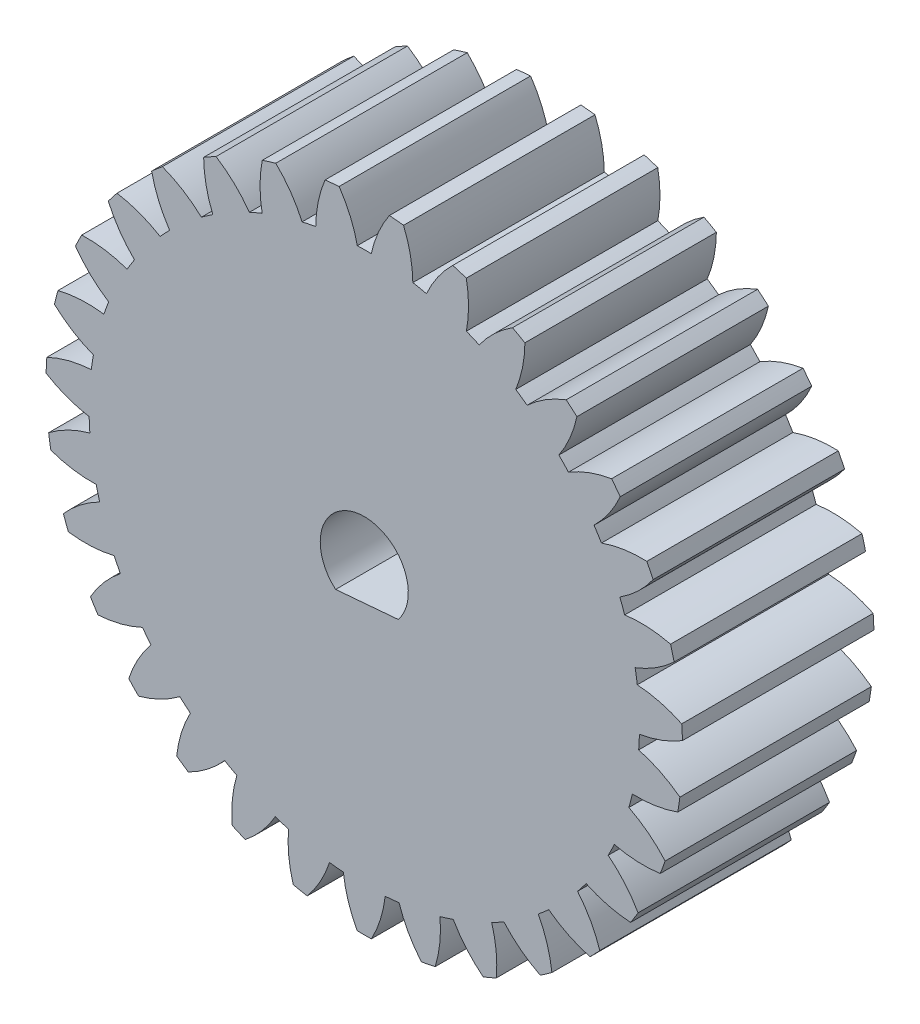
from build123d import *

# Parameters (mm, degrees)
BOSS_EXTRUDE1_DEPTH = 10


with BuildPart() as part:
    # Model → Boss-Extrude1 (new body)
    with BuildSketch(Plane.XY):
        with BuildLine():
            ThreePointArc((14.369367897, -0.364886625), (15.533878417, -0.05414421), (16.618302644, 0.4718498))
            ThreePointArc((16.618302644, 0.4718498), (16.603661932, 0.842042432), (16.58077576, 1.211816902))
            ThreePointArc((16.58077576, 1.211816902), (15.448701432, 1.625402827), (14.25872835, 1.816739348))
            ThreePointArc((14.25872835, 1.816739348), (14.208243694, 2.176622874), (14.148677229, 2.535115118))
            ThreePointArc((14.148677229, 2.535115118), (15.226798163, 3.073910862), (16.183142346, 3.807430735))
            ThreePointArc((16.183142346, 3.807430735), (16.094282101, 4.167098349), (15.997429357, 4.524696561))
            ThreePointArc((15.997429357, 4.524696561), (14.805274422, 4.701931471), (13.6011444, 4.649811502))
            ThreePointArc((13.6011444, 4.649811502), (13.479249148, 4.992165704), (13.348738054, 5.33132895))
            ThreePointArc((13.348738054, 5.33132895), (14.296331003, 6.076119662), (15.085442299, 6.987135009))
            ThreePointArc((15.085442299, 6.987135009), (14.92600047, 7.32155277), (14.759146317, 7.652334612))
            ThreePointArc((14.759146317, 7.652334612), (13.555717739, 7.585962488), (12.386728002, 7.292519826))
            ThreePointArc((12.386728002, 7.292519826), (12.198412557, 7.603328684), (12.002299974, 7.909277549))
            ThreePointArc((12.002299974, 7.909277549), (12.780570371, 8.829571409), (13.370142472, 9.880785155))
            ThreePointArc((13.370142472, 9.880785155), (13.146646627, 10.17626196), (12.916622092, 10.466685184))
            ThreePointArc((12.916622092, 10.466685184), (11.751188378, 10.15942331), (10.665197503, 9.636671533))
            ThreePointArc((10.665197503, 9.636671533), (10.418171524, 9.903210495), (10.164486323, 10.163419395))
            ThreePointArc((10.164486323, 10.163419395), (10.741571688, 11.221539465), (11.107467442, 12.369914795))
            ThreePointArc((11.107467442, 12.369914795), (10.829067525, 12.61435379), (10.545289841, 12.852528435))
            ThreePointArc((10.545289841, 12.852528435), (9.465563984, 12.316956148), (8.507032565, 11.586296774))
            ThreePointArc((8.507032565, 11.586296774), (8.211409324, 11.797653704), (7.910537407, 12.001469657))
            ThreePointArc((7.910537407, 12.001469657), (8.262811797, 13.154096377), (8.390051389, 14.35261867))
            ThreePointArc((8.390051389, 14.35261867), (8.068145127, 14.536012493), (7.742232185, 14.712187662))
            ThreePointArc((7.742232185, 14.712187662), (6.792418289, 13.970231354), (6.000588715, 13.061577664))
            ThreePointArc((6.000588715, 13.061577664), (5.668471061, 13.209099584), (5.332730161, 13.348178341))
            ThreePointArc((5.332730161, 13.348178341), (5.44577142, 14.548123038), (5.329145646, 15.747724651))
            ThreePointArc((5.329145646, 15.747724651), (4.97691192, 15.862565138), (4.622206634, 15.969528197))
            ThreePointArc((4.622206634, 15.969528197), (3.84119019, 15.051563646), (3.248480058, 14.00211603))
            ThreePointArc((3.248480058, 14.00211603), (2.893464928, 14.079763376), (2.536600316, 14.148411036))
            ThreePointArc((2.536600316, 14.148411036), (2.405780521, 15.346547832), (2.050064055, 16.498116934))
            ThreePointArc((2.050064055, 16.498116934), (1.681923353, 16.539702501), (1.3129474, 16.573074372))
            ThreePointArc((1.3129474, 16.573074372), (0.732703314, 15.516683155), (0.363378245, 14.36940612))
            ThreePointArc((0.363378245, 14.36940612), (0, 14.374), (-0.363378245, 14.36940612))
            ThreePointArc((-0.363378245, 14.36940612), (-0.732703314, 15.516683155), (-1.3129474, 16.573074372))
            ThreePointArc((-1.3129474, 16.573074372), (-1.681923353, 16.539702501), (-2.050064055, 16.498116934))
            ThreePointArc((-2.050064055, 16.498116934), (-2.405780521, 15.346547832), (-2.536600315, 14.148411036))
            ThreePointArc((-2.536600315, 14.148411036), (-2.893464928, 14.079763376), (-3.248480058, 14.00211603))
            ThreePointArc((-3.248480058, 14.00211603), (-3.84119019, 15.051563647), (-4.622206634, 15.969528197))
            ThreePointArc((-4.622206634, 15.969528197), (-4.976911919, 15.862565138), (-5.329145646, 15.747724651))
            ThreePointArc((-5.329145646, 15.747724651), (-5.44577142, 14.548123037), (-5.33273016, 13.34817834))
            ThreePointArc((-5.33273016, 13.34817834), (-5.668471061, 13.209099583), (-6.000588714, 13.061577663))
            ThreePointArc((-6.000588714, 13.061577663), (-6.792418288, 13.970231353), (-7.742232185, 14.71218766))
            ThreePointArc((-7.742232185, 14.71218766), (-8.068145126, 14.536012492), (-8.390051388, 14.352618669))
            ThreePointArc((-8.390051388, 14.352618669), (-8.262811796, 13.154096376), (-7.910537407, 12.001469656))
            ThreePointArc((-7.910537407, 12.001469656), (-8.211409323, 11.797653703), (-8.507032564, 11.586296773))
            ThreePointArc((-8.507032564, 11.586296773), (-9.465563983, 12.316956147), (-10.54528984, 12.852528434))
            ThreePointArc((-10.54528984, 12.852528434), (-10.829067524, 12.614353789), (-11.107467441, 12.369914794))
            ThreePointArc((-11.107467441, 12.369914794), (-10.741571687, 11.221539464), (-10.164486322, 10.163419394))
            ThreePointArc((-10.164486322, 10.163419394), (-10.418171523, 9.903210494), (-10.665197502, 9.636671532))
            ThreePointArc((-10.665197502, 9.636671532), (-11.751188377, 10.159423309), (-12.916622091, 10.466685183))
            ThreePointArc((-12.916622091, 10.466685183), (-13.146646626, 10.176261959), (-13.370142471, 9.880785154))
            ThreePointArc((-13.370142471, 9.880785154), (-12.78057037, 8.829571408), (-12.002299973, 7.909277548))
            ThreePointArc((-12.002299973, 7.909277548), (-12.198412556, 7.603328684), (-12.386728, 7.292519826))
            ThreePointArc((-12.386728, 7.292519826), (-13.555717737, 7.585962488), (-14.759146315, 7.652334611))
            ThreePointArc((-14.759146315, 7.652334611), (-14.926000469, 7.321552769), (-15.085442298, 6.987135008))
            ThreePointArc((-15.085442298, 6.987135008), (-14.296331002, 6.076119661), (-13.348738053, 5.33132895))
            ThreePointArc((-13.348738053, 5.33132895), (-13.479249146, 4.992165704), (-13.601144399, 4.649811501))
            ThreePointArc((-13.601144399, 4.649811501), (-14.805274421, 4.701931471), (-15.997429356, 4.524696561))
            ThreePointArc((-15.997429356, 4.524696561), (-16.0942821, 4.167098349), (-16.183142345, 3.807430735))
            ThreePointArc((-16.183142345, 3.807430735), (-15.226798162, 3.073910862), (-14.148677228, 2.535115118))
            ThreePointArc((-14.148677228, 2.535115118), (-14.208243693, 2.176622874), (-14.258728348, 1.816739348))
            ThreePointArc((-14.258728348, 1.816739348), (-15.448701431, 1.625402827), (-16.580775759, 1.211816902))
            ThreePointArc((-16.580775759, 1.211816902), (-16.603661931, 0.842042432), (-16.618302643, 0.4718498))
            ThreePointArc((-16.618302643, 0.4718498), (-15.533878417, -0.05414421), (-14.369367896, -0.364886625))
            ThreePointArc((-14.369367896, -0.364886625), (-14.355551073, -0.728031153), (-14.332558284, -1.090710328))
            ThreePointArc((-14.332558284, -1.090710328), (-15.459656789, -1.51767), (-16.485303254, -2.150674683))
            ThreePointArc((-16.485303254, -2.150674683), (-16.433285891, -2.517486801), (-16.373107678, -2.883048722))
            ThreePointArc((-16.373107678, -2.883048722), (-15.204999864, -3.179982611), (-14.001774953, -3.249949866))
            ThreePointArc((-14.001774953, -3.249949866), (-13.915140506, -3.602879499), (-13.819611599, -3.953506196))
            ThreePointArc((-13.819611599, -3.953506196), (-14.837691981, -4.598609238), (-15.714920497, -5.425117395))
            ThreePointArc((-15.714920497, -5.425117395), (-15.590129196, -5.773949828), (-15.457595761, -6.11991489))
            ThreePointArc((-15.457595761, -6.11991489), (-14.25362683, -6.175632151), (-13.060947699, -6.001959778))
            ThreePointArc((-13.060947699, -6.001959778), (-12.905042451, -6.330225534), (-12.740888391, -6.654445055))
            ThreePointArc((-12.740888391, -6.654445055), (-13.608270321, -7.491280875), (-14.301167049, -8.477455162))
            ThreePointArc((-14.301167049, -8.477455162), (-14.10871078, -8.794026671), (-13.909248058, -9.106231024))
            ThreePointArc((-13.909248058, -9.106231024), (-12.718708639, -8.918450585), (-11.585403712, -8.508248752))
            ThreePointArc((-11.585403712, -8.508248752), (-11.366610442, -8.798411393), (-11.140551716, -9.082950151))
            ThreePointArc((-11.140551716, -9.082950151), (-11.821724474, -10.077258592), (-12.301922141, -11.18272492))
            ThreePointArc((-12.301922141, -11.18272492), (-12.049680087, -11.454075029), (-11.791454104, -11.71973699))
            ThreePointArc((-11.791454104, -11.71973699), (-10.663085021, -11.296146604), (-9.635551935, -10.666209022))
            ThreePointArc((-9.635551935, -10.666209022), (-9.362828066, -10.906389255), (-9.084119544, -11.139598202))
            ThreePointArc((-9.084119544, -11.139598202), (-9.551195839, -12.250672158), (-9.799035095, -13.430172605))
            ThreePointArc((-9.799035095, -13.430172605), (-9.497334076, -13.64519221), (-9.190916634, -13.853435546))
            ThreePointArc((-9.190916634, -13.853435546), (-8.170913451, -13.211377054), (-7.29121953, -12.387493442))
            ThreePointArc((-7.29121953, -12.387493442), (-6.975730409, -12.56785826), (-6.655782451, -12.740189793))
            ThreePointArc((-6.655782451, -12.740189793), (-6.889640123, -13.922541767), (-6.894974401, -15.127787446))
            ThreePointArc((-6.894974401, -15.127787446), (-6.556166091, -15.277673618), (-6.214101957, -15.419972823))
            ThreePointArc((-6.214101957, -15.419972823), (-5.344223723, -14.585732175), (-4.64838374, -13.601632424))
            ThreePointArc((-4.64838374, -13.601632424), (-4.30304553, -13.714797671), (-3.954956843, -13.819196517))
            ThreePointArc((-3.954956843, -13.819196517), (-3.946021732, -15.02442088), (-3.708632645, -16.206068891))
            ThreePointArc((-3.708632645, -16.206068891), (-3.346587896, -16.284685273), (-2.982881216, -16.355214601))
            ThreePointArc((-2.982881216, -16.355214601), (-2.298740848, -15.362945707), (-1.815242574, -14.258918977))
            ThreePointArc((-1.815242574, -14.258918977), (-1.45419346, -14.300251654), (-1.092214836, -14.332443712))
            ThreePointArc((-1.092214836, -14.332443712), (-0.840852747, -15.511198437), (-0.370459033, -16.620871972))
            ThreePointArc((-0.370459033, -16.620871972), (0, -16.625), (0.370459033, -16.620871972))
            ThreePointArc((0.370459033, -16.620871972), (0.840852747, -15.511198437), (1.092214836, -14.332443712))
            ThreePointArc((1.092214836, -14.332443712), (1.45419346, -14.300251654), (1.815242574, -14.258918977))
            ThreePointArc((1.815242574, -14.258918977), (2.298740848, -15.362945707), (2.982881216, -16.355214601))
            ThreePointArc((2.982881216, -16.355214601), (3.346587897, -16.284685273), (3.708632645, -16.206068891))
            ThreePointArc((3.708632645, -16.206068891), (3.946021732, -15.02442088), (3.954956843, -13.819196517))
            ThreePointArc((3.954956843, -13.819196517), (4.30304553, -13.714797671), (4.64838374, -13.601632424))
            ThreePointArc((4.64838374, -13.601632424), (5.344223723, -14.585732175), (6.214101957, -15.419972823))
            ThreePointArc((6.214101957, -15.419972823), (6.556166091, -15.277673618), (6.894974401, -15.127787446))
            ThreePointArc((6.894974401, -15.127787446), (6.889640124, -13.922541767), (6.655782452, -12.740189793))
            ThreePointArc((6.655782452, -12.740189793), (6.975730409, -12.56785826), (7.29121953, -12.387493442))
            ThreePointArc((7.29121953, -12.387493442), (8.170913451, -13.211377054), (9.190916634, -13.853435546))
            ThreePointArc((9.190916634, -13.853435546), (9.497334076, -13.64519221), (9.799035095, -13.430172605))
            ThreePointArc((9.799035095, -13.430172605), (9.551195839, -12.250672158), (9.084119545, -11.139598202))
            ThreePointArc((9.084119545, -11.139598202), (9.362828067, -10.906389256), (9.635551935, -10.666209022))
            ThreePointArc((9.635551935, -10.666209022), (10.663085022, -11.296146604), (11.791454104, -11.71973699))
            ThreePointArc((11.791454104, -11.71973699), (12.049680088, -11.45407503), (12.301922141, -11.18272492))
            ThreePointArc((12.301922141, -11.18272492), (11.821724475, -10.077258592), (11.140551716, -9.082950152))
            ThreePointArc((11.140551716, -9.082950152), (11.366610443, -8.798411393), (11.585403712, -8.508248752))
            ThreePointArc((11.585403712, -8.508248752), (12.718708639, -8.918450585), (13.909248058, -9.106231024))
            ThreePointArc((13.909248058, -9.106231024), (14.108710781, -8.794026672), (14.301167049, -8.477455163))
            ThreePointArc((14.301167049, -8.477455163), (13.608270321, -7.491280875), (12.740888392, -6.654445055))
            ThreePointArc((12.740888392, -6.654445055), (12.905042452, -6.330225534), (13.0609477, -6.001959779))
            ThreePointArc((13.0609477, -6.001959779), (14.25362683, -6.175632151), (15.457595762, -6.119914891))
            ThreePointArc((15.457595762, -6.119914891), (15.590129197, -5.773949829), (15.714920498, -5.425117395))
            ThreePointArc((15.714920498, -5.425117395), (14.837691982, -4.598609239), (13.8196116, -3.953506196))
            ThreePointArc((13.8196116, -3.953506196), (13.915140507, -3.602879499), (14.001774954, -3.249949866))
            ThreePointArc((14.001774954, -3.249949866), (15.204999864, -3.179982612), (16.373107679, -2.883048722))
            ThreePointArc((16.373107679, -2.883048722), (16.433285892, -2.517486801), (16.485303255, -2.150674684))
            ThreePointArc((16.485303255, -2.150674684), (15.45965679, -1.51767), (14.332558285, -1.090710329))
            ThreePointArc((14.332558285, -1.090710329), (14.355551074, -0.728031153), (14.369367897, -0.364886625))
        make_face()
        with BuildLine():
            Line((-1.496390861, -1.746645554), (1.76872006, -1.470233196))
            ThreePointArc((1.76872006, -1.470233196), (-0.194014809, 2.291792867), (-1.496390861, -1.746645554))
        make_face(mode=Mode.SUBTRACT)
    extrude(amount=BOSS_EXTRUDE1_DEPTH)


solid = part.part
